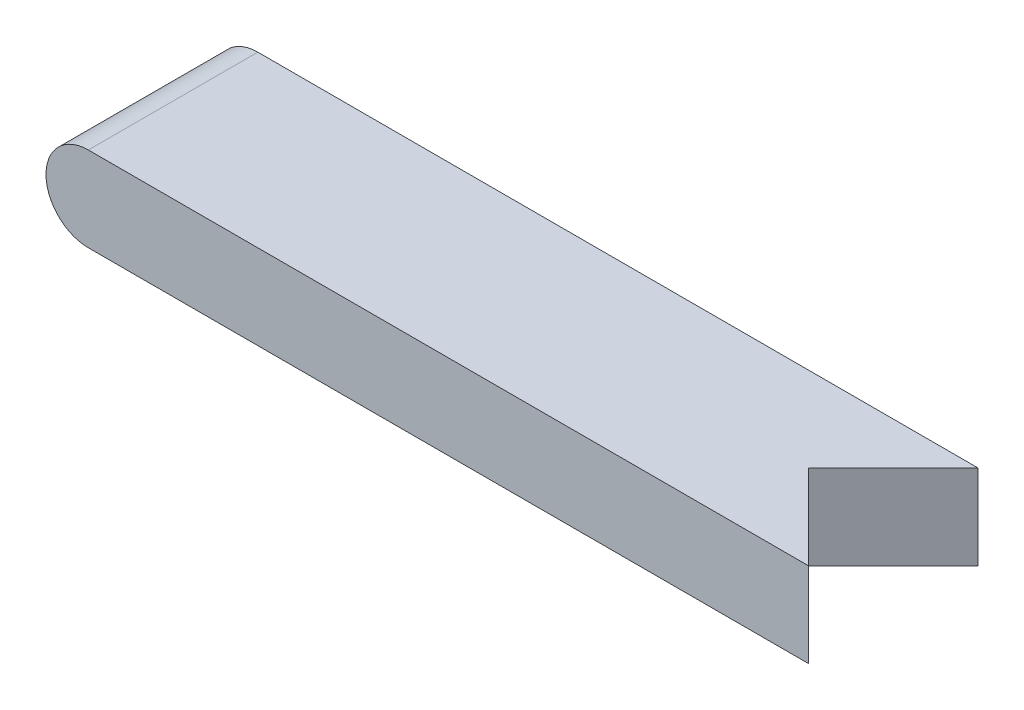
from build123d import *

# Parameters (mm, degrees)
BOSS_EXTRUDE1_DEPTH = 2.54
FILLET1_R           = 1.27
CUT_EXTRUDE2_DEPTH  = 2.54


with BuildPart() as part:
    # Sketch1 → Boss-Extrude1 (new body)
    with BuildSketch(Plane(origin=(0, 0, 0), x_dir=(1, 0, 0), z_dir=(0, 1, 0))):
        Polygon((12.7, 0), (0, 0), (-10.16, 0), (-10.16, 5.08), (12.7, 5.08), align=None)
    extrude(amount=BOSS_EXTRUDE1_DEPTH)

    # Fillet1
    fillet1_edges = [part.edges().sort_by_distance(p)[0] for p in [
        (-10.16, 0, -2.54),
        (-10.16, 2.54, -2.54),
    ]]
    fillet(fillet1_edges, radius=FILLET1_R - 0.0001)  # a hair under: the kernel refuses the full size

    # Sketch3 → Cut-Extrude2 (cut)
    with BuildSketch(Plane(origin=(0, 2.54, 0), x_dir=(1, 0, 0), z_dir=(0, 1, 0))):
        Polygon((12.7, 5.08), (10.16, 2.54), (12.7, 0), align=None)
    extrude(amount=-CUT_EXTRUDE2_DEPTH, mode=Mode.SUBTRACT)


solid = part.part
